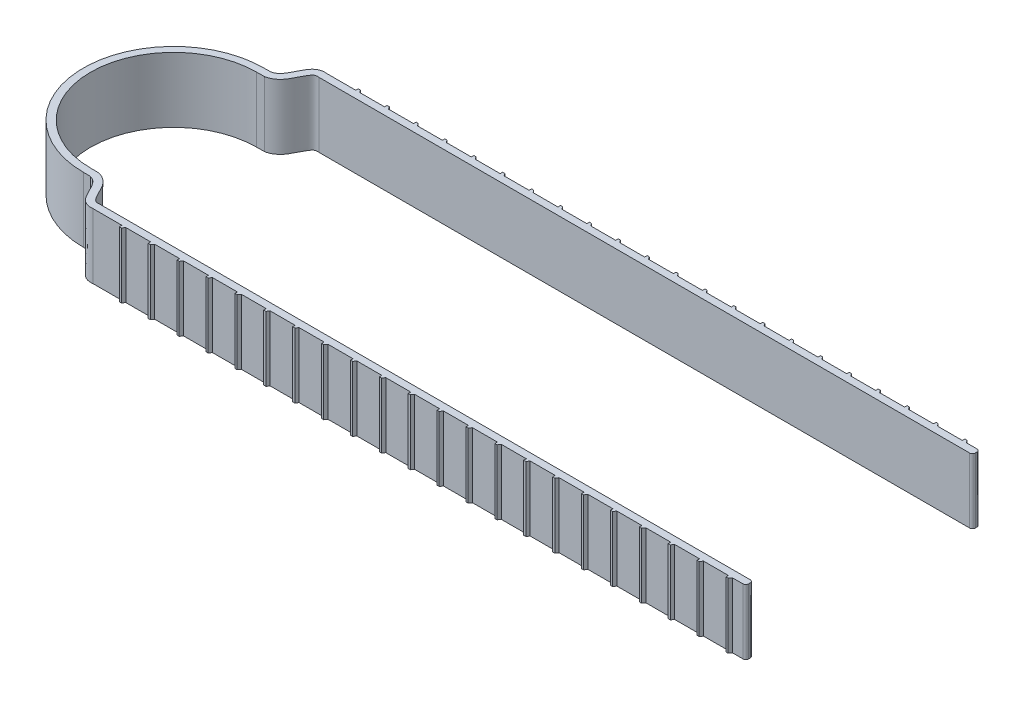
from build123d import *

# Parameters (mm, degrees)
BOSS_EXTRUDE1_DEPTH = 18
MIRROR1_DEPTH       = 18


# Read off the part's stored shape, not the designer's step: Mirror1
with BuildPart() as part:
    # Sketch1 → Boss-Extrude1 (new body)
    with BuildSketch(Plane(origin=(0, 0, 0), x_dir=(1, 0, 0), z_dir=(0, 1, 0))):
        with BuildLine():
            Line((0, -25), (1.941802876, -25.022205331))
            add(Edge.make_bspline(
                [(1.941802876, -25.022205331), (2.694513099, -25.199398419), (4.583645276, -26.500849808), (5.862872048, -30.816766083), (8.252463805, -32.591061014), (10.049383801, -32.386649709)],
                knots=[0.122516909, 0.122516909, 0.122516909, 0.122516909, 0.292834345, 0.695813035, 1, 1, 1, 1], degree=3))
            Line((10.049383801, -32.386649709), (18.049383801, -32.386649709))
            Line((18.049383801, -32.386649709), (18.049383801, -33.086649709))
            Line((18.049383801, -33.086649709), (18.647402695, -33.086649709))
            Line((18.647402695, -33.086649709), (19.147402695, -32.386649709))
            Line((19.147402695, -32.386649709), (26.049383801, -32.386649709))
            Line((26.049383801, -32.386649709), (26.049383801, -33.086649709))
            Line((26.049383801, -33.086649709), (26.647402695, -33.086649709))
            Line((26.647402695, -33.086649709), (27.147402695, -32.386649709))
            Line((27.147402695, -32.386649709), (34.049383801, -32.386649709))
            Line((34.049383801, -32.386649709), (34.049383801, -33.086649709))
            Line((34.049383801, -33.086649709), (34.647402695, -33.086649709))
            Line((34.647402695, -33.086649709), (35.147402695, -32.386649709))
            Line((35.147402695, -32.386649709), (42.049383801, -32.386649709))
            Line((42.049383801, -32.386649709), (42.049383801, -33.086649709))
            Line((42.049383801, -33.086649709), (42.647402695, -33.086649709))
            Line((42.647402695, -33.086649709), (43.147402695, -32.386649709))
            Line((43.147402695, -32.386649709), (50.049383801, -32.386649709))
            Line((50.049383801, -32.386649709), (50.049383801, -33.086649709))
            Line((50.049383801, -33.086649709), (50.647402695, -33.086649709))
            Line((50.647402695, -33.086649709), (51.147402695, -32.386649709))
            Line((51.147402695, -32.386649709), (58.049383801, -32.386649709))
            Line((58.049383801, -32.386649709), (58.049383801, -33.086649709))
            Line((58.049383801, -33.086649709), (58.647402695, -33.086649709))
            Line((58.647402695, -33.086649709), (59.147402695, -32.386649709))
            Line((59.147402695, -32.386649709), (66.049383801, -32.386649709))
            Line((66.049383801, -32.386649709), (66.049383801, -33.086649709))
            Line((66.049383801, -33.086649709), (66.647402695, -33.086649709))
            Line((66.647402695, -33.086649709), (67.147402695, -32.386649709))
            Line((67.147402695, -32.386649709), (74.049383801, -32.386649709))
            Line((74.049383801, -32.386649709), (74.049383801, -33.086649709))
            Line((74.049383801, -33.086649709), (74.647402695, -33.086649709))
            Line((74.647402695, -33.086649709), (75.147402695, -32.386649709))
            Line((75.147402695, -32.386649709), (82.049383801, -32.386649709))
            Line((82.049383801, -32.386649709), (82.049383801, -33.086649709))
            Line((82.049383801, -33.086649709), (82.647402695, -33.086649709))
            Line((82.647402695, -33.086649709), (83.147402695, -32.386649709))
            Line((83.147402695, -32.386649709), (90.049383801, -32.386649709))
            Line((90.049383801, -32.386649709), (90.049383801, -33.086649709))
            Line((90.049383801, -33.086649709), (90.647402695, -33.086649709))
            Line((90.647402695, -33.086649709), (91.147402695, -32.386649709))
            Line((91.147402695, -32.386649709), (98.049383801, -32.386649709))
            Line((98.049383801, -32.386649709), (98.049383801, -33.086649709))
            Line((98.049383801, -33.086649709), (98.647402695, -33.086649709))
            Line((98.647402695, -33.086649709), (99.147402695, -32.386649709))
            Line((99.147402695, -32.386649709), (106.049383801, -32.386649709))
            Line((106.049383801, -32.386649709), (106.049383801, -33.086649709))
            Line((106.049383801, -33.086649709), (106.647402695, -33.086649709))
            Line((106.647402695, -33.086649709), (107.147402695, -32.386649709))
            Line((107.147402695, -32.386649709), (114.049383801, -32.386649709))
            Line((114.049383801, -32.386649709), (114.049383801, -33.086649709))
            Line((114.049383801, -33.086649709), (114.647402695, -33.086649709))
            Line((114.647402695, -33.086649709), (115.147402695, -32.386649709))
            Line((115.147402695, -32.386649709), (122.049383801, -32.386649709))
            Line((122.049383801, -32.386649709), (122.049383801, -33.086649709))
            Line((122.049383801, -33.086649709), (122.647402695, -33.086649709))
            Line((122.647402695, -33.086649709), (123.147402695, -32.386649709))
            Line((123.147402695, -32.386649709), (130.049383801, -32.386649709))
            Line((130.049383801, -32.386649709), (130.049383801, -33.086649709))
            Line((130.049383801, -33.086649709), (130.647402695, -33.086649709))
            Line((130.647402695, -33.086649709), (131.147402695, -32.386649709))
            Line((131.147402695, -32.386649709), (138.049383801, -32.386649709))
            Line((138.049383801, -32.386649709), (138.049383801, -33.086649709))
            Line((138.049383801, -33.086649709), (138.647402695, -33.086649709))
            Line((138.647402695, -33.086649709), (139.147402695, -32.386649709))
            Line((139.147402695, -32.386649709), (146.049383801, -32.386649709))
            Line((146.049383801, -32.386649709), (146.049383801, -33.086649709))
            Line((146.049383801, -33.086649709), (146.647402695, -33.086649709))
            Line((146.647402695, -33.086649709), (147.147402695, -32.386649709))
            Line((147.147402695, -32.386649709), (154.049383801, -32.386649709))
            Line((154.049383801, -32.386649709), (154.049383801, -33.086649709))
            Line((154.049383801, -33.086649709), (154.647402695, -33.086649709))
            Line((154.647402695, -33.086649709), (155.147402695, -32.386649709))
            Line((155.147402695, -32.386649709), (162.049383801, -32.386649709))
            Line((162.049383801, -32.386649709), (162.049383801, -33.086649709))
            Line((162.049383801, -33.086649709), (162.647402695, -33.086649709))
            Line((162.647402695, -33.086649709), (163.147402695, -32.386649709))
            Line((163.147402695, -32.386649709), (170.049383801, -32.386649709))
            Line((170.049383801, -32.386649709), (170.049383801, -33.086649709))
            Line((170.049383801, -33.086649709), (170.647402695, -33.086649709))
            Line((170.647402695, -33.086649709), (171.147402695, -32.386649709))
            Line((171.147402695, -32.386649709), (178.049383801, -32.386649709))
            Line((178.049383801, -32.386649709), (178.049383801, -33.086649709))
            Line((178.049383801, -33.086649709), (178.647402695, -33.086649709))
            Line((178.647402695, -33.086649709), (179.147402695, -32.386649709))
            Line((179.147402695, -32.386649709), (186.049383801, -32.386649709))
            Line((186.049383801, -32.386649709), (186.049383801, -33.086649709))
            Line((186.049383801, -33.086649709), (186.647402695, -33.086649709))
            Line((186.647402695, -33.086649709), (187.147402695, -32.386649709))
            Line((187.147402695, -32.386649709), (190.049383801, -32.386649709))
            ThreePointArc((190.049383801, -32.386649709), (190.615069226, -32.152335134), (190.849383801, -31.586649709))
            Line((190.849383801, -31.586649709), (190.849383801, -31.186649709))
            ThreePointArc((190.849383801, -31.186649709), (190.615069226, -30.620964284), (190.049383801, -30.386649709))
            Line((190.049383801, -30.386649709), (9.93599297, -30.386649709))
            add(Edge.make_bspline(
                [(2.185309042, -23.024859162), (2.247460392, -23.039490011), (2.346321817, -23.062006287), (2.647261611, -23.136253234), (2.923898935, -23.22383025), (3.470085898, -23.427903029), (4.216853457, -23.837285539), (5.022611902, -24.528466695), (5.861197136, -25.53128028), (6.601465817, -26.821251496), (7.291356169, -28.260184), (7.930528695, -29.442623823), (8.428629085, -30.038718723), (8.744339463, -30.260700749), (8.976455795, -30.363308574), (9.260428021, -30.417496681), (9.537954475, -30.422409713), (9.717945517, -30.410361222), (9.803110841, -30.401971149), (9.895881578, -30.39121264), (9.93599297, -30.386649709)],
                knots=[0.106317301, 0.106317301, 0.106317301, 0.106317301, 0.120380427, 0.134443553, 0.148506678, 0.162569804, 0.218822308, 0.275074811, 0.331327315, 0.443832322, 0.556337329, 0.668842336, 0.781347343, 0.837599846, 0.89385235, 0.950104853, 0.978231105, 0.992294231, 0.999325794, 1.006357357, 1.006357357, 1.006357357, 1.006357357], degree=3))
            Line((2.185309042, -23.024859162), (0.01119672, -22.999997275))
            ThreePointArc((0.01119672, -22.999997275), (-16.259496847, -16.267414124), (-23, 0))
            Line((-23, 0), (-25, 0))
            ThreePointArc((-25, 0), (-17.67766953, -17.67766953), (0, -25))
        make_face()
    extrude(amount=BOSS_EXTRUDE1_DEPTH)

    # Mirror1 outline → Mirror1 (add)
    with BuildSketch(Plane(origin=(0, 0, 0), x_dir=(1, 0, 0), z_dir=(0, 1, 0))):
        with BuildLine():
            add(Edge.make_bspline(
                [(1.941802876, 25.022205331), (2.694513099, 25.199398419), (4.583645276, 26.500849808), (5.862872048, 30.816766083), (8.252463805, 32.591061014), (10.049383801, 32.386649709)],
                knots=[0.122516909, 0.122516909, 0.122516909, 0.122516909, 0.292834345, 0.695813035, 1, 1, 1, 1], degree=3))
            Line((1.941802876, 25.022205331), (0, 25))
            ThreePointArc((0, 25), (-17.67766953, 17.67766953), (-25, 0))
            Line((-25, 0), (-23, 0))
            ThreePointArc((-23, 0), (-16.259496847, 16.267414124), (0.01119672, 22.999997275))
            Line((0.01119672, 22.999997275), (2.185309042, 23.024859162))
            add(Edge.make_bspline(
                [(9.93599297, 30.386649709), (9.895881578, 30.39121264), (9.803110841, 30.401971149), (9.717945517, 30.410361222), (9.537954475, 30.422409713), (9.260428021, 30.417496681), (8.976455795, 30.363308574), (8.744339463, 30.260700749), (8.428629085, 30.038718723), (7.930528695, 29.442623823), (7.291356169, 28.260184), (6.601465817, 26.821251496), (5.861197136, 25.53128028), (5.022611902, 24.528466695), (4.216853457, 23.837285539), (3.470085898, 23.427903029), (2.923898935, 23.22383025), (2.647261611, 23.136253234), (2.346321817, 23.062006287), (2.247460392, 23.039490011), (2.185309042, 23.024859162)],
                knots=[0.106317301, 0.106317301, 0.106317301, 0.106317301, 0.113348864, 0.120380427, 0.134443553, 0.162569804, 0.218822308, 0.275074811, 0.331327315, 0.443832322, 0.556337329, 0.668842336, 0.781347343, 0.837599846, 0.89385235, 0.950104853, 0.964167979, 0.978231105, 0.992294231, 1.006357357, 1.006357357, 1.006357357, 1.006357357], degree=3))
            Line((9.93599297, 30.386649709), (190.049383801, 30.386649709))
            ThreePointArc((190.049383801, 30.386649709), (190.615069226, 30.620964284), (190.849383801, 31.186649709))
            Line((190.849383801, 31.186649709), (190.849383801, 31.586649709))
            ThreePointArc((190.849383801, 31.586649709), (190.615069226, 32.152335134), (190.049383801, 32.386649709))
            Line((190.049383801, 32.386649709), (187.147402695, 32.386649709))
            Line((187.147402695, 32.386649709), (186.647402695, 33.086649709))
            Line((186.647402695, 33.086649709), (186.049383801, 33.086649709))
            Line((186.049383801, 33.086649709), (186.049383801, 32.386649709))
            Line((186.049383801, 32.386649709), (179.147402695, 32.386649709))
            Line((179.147402695, 32.386649709), (178.647402695, 33.086649709))
            Line((178.647402695, 33.086649709), (178.049383801, 33.086649709))
            Line((178.049383801, 33.086649709), (178.049383801, 32.386649709))
            Line((178.049383801, 32.386649709), (171.147402695, 32.386649709))
            Line((171.147402695, 32.386649709), (170.647402695, 33.086649709))
            Line((170.647402695, 33.086649709), (170.049383801, 33.086649709))
            Line((170.049383801, 33.086649709), (170.049383801, 32.386649709))
            Line((170.049383801, 32.386649709), (163.147402695, 32.386649709))
            Line((163.147402695, 32.386649709), (162.647402695, 33.086649709))
            Line((162.647402695, 33.086649709), (162.049383801, 33.086649709))
            Line((162.049383801, 33.086649709), (162.049383801, 32.386649709))
            Line((162.049383801, 32.386649709), (155.147402695, 32.386649709))
            Line((155.147402695, 32.386649709), (154.647402695, 33.086649709))
            Line((154.647402695, 33.086649709), (154.049383801, 33.086649709))
            Line((154.049383801, 33.086649709), (154.049383801, 32.386649709))
            Line((154.049383801, 32.386649709), (147.147402695, 32.386649709))
            Line((147.147402695, 32.386649709), (146.647402695, 33.086649709))
            Line((146.647402695, 33.086649709), (146.049383801, 33.086649709))
            Line((146.049383801, 33.086649709), (146.049383801, 32.386649709))
            Line((146.049383801, 32.386649709), (139.147402695, 32.386649709))
            Line((139.147402695, 32.386649709), (138.647402695, 33.086649709))
            Line((138.647402695, 33.086649709), (138.049383801, 33.086649709))
            Line((138.049383801, 33.086649709), (138.049383801, 32.386649709))
            Line((138.049383801, 32.386649709), (131.147402695, 32.386649709))
            Line((131.147402695, 32.386649709), (130.647402695, 33.086649709))
            Line((130.647402695, 33.086649709), (130.049383801, 33.086649709))
            Line((130.049383801, 33.086649709), (130.049383801, 32.386649709))
            Line((130.049383801, 32.386649709), (123.147402695, 32.386649709))
            Line((123.147402695, 32.386649709), (122.647402695, 33.086649709))
            Line((122.647402695, 33.086649709), (122.049383801, 33.086649709))
            Line((122.049383801, 33.086649709), (122.049383801, 32.386649709))
            Line((122.049383801, 32.386649709), (115.147402695, 32.386649709))
            Line((115.147402695, 32.386649709), (114.647402695, 33.086649709))
            Line((114.647402695, 33.086649709), (114.049383801, 33.086649709))
            Line((114.049383801, 33.086649709), (114.049383801, 32.386649709))
            Line((114.049383801, 32.386649709), (107.147402695, 32.386649709))
            Line((107.147402695, 32.386649709), (106.647402695, 33.086649709))
            Line((106.647402695, 33.086649709), (106.049383801, 33.086649709))
            Line((106.049383801, 33.086649709), (106.049383801, 32.386649709))
            Line((106.049383801, 32.386649709), (99.147402695, 32.386649709))
            Line((99.147402695, 32.386649709), (98.647402695, 33.086649709))
            Line((98.647402695, 33.086649709), (98.049383801, 33.086649709))
            Line((98.049383801, 33.086649709), (98.049383801, 32.386649709))
            Line((98.049383801, 32.386649709), (91.147402695, 32.386649709))
            Line((91.147402695, 32.386649709), (90.647402695, 33.086649709))
            Line((90.647402695, 33.086649709), (90.049383801, 33.086649709))
            Line((90.049383801, 33.086649709), (90.049383801, 32.386649709))
            Line((90.049383801, 32.386649709), (83.147402695, 32.386649709))
            Line((83.147402695, 32.386649709), (82.647402695, 33.086649709))
            Line((82.647402695, 33.086649709), (82.049383801, 33.086649709))
            Line((82.049383801, 33.086649709), (82.049383801, 32.386649709))
            Line((82.049383801, 32.386649709), (75.147402695, 32.386649709))
            Line((75.147402695, 32.386649709), (74.647402695, 33.086649709))
            Line((74.647402695, 33.086649709), (74.049383801, 33.086649709))
            Line((74.049383801, 33.086649709), (74.049383801, 32.386649709))
            Line((74.049383801, 32.386649709), (67.147402695, 32.386649709))
            Line((67.147402695, 32.386649709), (66.647402695, 33.086649709))
            Line((66.647402695, 33.086649709), (66.049383801, 33.086649709))
            Line((66.049383801, 33.086649709), (66.049383801, 32.386649709))
            Line((66.049383801, 32.386649709), (59.147402695, 32.386649709))
            Line((59.147402695, 32.386649709), (58.647402695, 33.086649709))
            Line((58.647402695, 33.086649709), (58.049383801, 33.086649709))
            Line((58.049383801, 33.086649709), (58.049383801, 32.386649709))
            Line((58.049383801, 32.386649709), (51.147402695, 32.386649709))
            Line((51.147402695, 32.386649709), (50.647402695, 33.086649709))
            Line((50.647402695, 33.086649709), (50.049383801, 33.086649709))
            Line((50.049383801, 33.086649709), (50.049383801, 32.386649709))
            Line((50.049383801, 32.386649709), (43.147402695, 32.386649709))
            Line((43.147402695, 32.386649709), (42.647402695, 33.086649709))
            Line((42.647402695, 33.086649709), (42.049383801, 33.086649709))
            Line((42.049383801, 33.086649709), (42.049383801, 32.386649709))
            Line((42.049383801, 32.386649709), (35.147402695, 32.386649709))
            Line((35.147402695, 32.386649709), (34.647402695, 33.086649709))
            Line((34.647402695, 33.086649709), (34.049383801, 33.086649709))
            Line((34.049383801, 33.086649709), (34.049383801, 32.386649709))
            Line((34.049383801, 32.386649709), (27.147402695, 32.386649709))
            Line((27.147402695, 32.386649709), (26.647402695, 33.086649709))
            Line((26.647402695, 33.086649709), (26.049383801, 33.086649709))
            Line((26.049383801, 33.086649709), (26.049383801, 32.386649709))
            Line((26.049383801, 32.386649709), (19.147402695, 32.386649709))
            Line((19.147402695, 32.386649709), (18.647402695, 33.086649709))
            Line((18.647402695, 33.086649709), (18.049383801, 33.086649709))
            Line((18.049383801, 33.086649709), (18.049383801, 32.386649709))
            Line((18.049383801, 32.386649709), (10.049383801, 32.386649709))
        make_face()
    extrude(amount=MIRROR1_DEPTH)


solid = part.part
